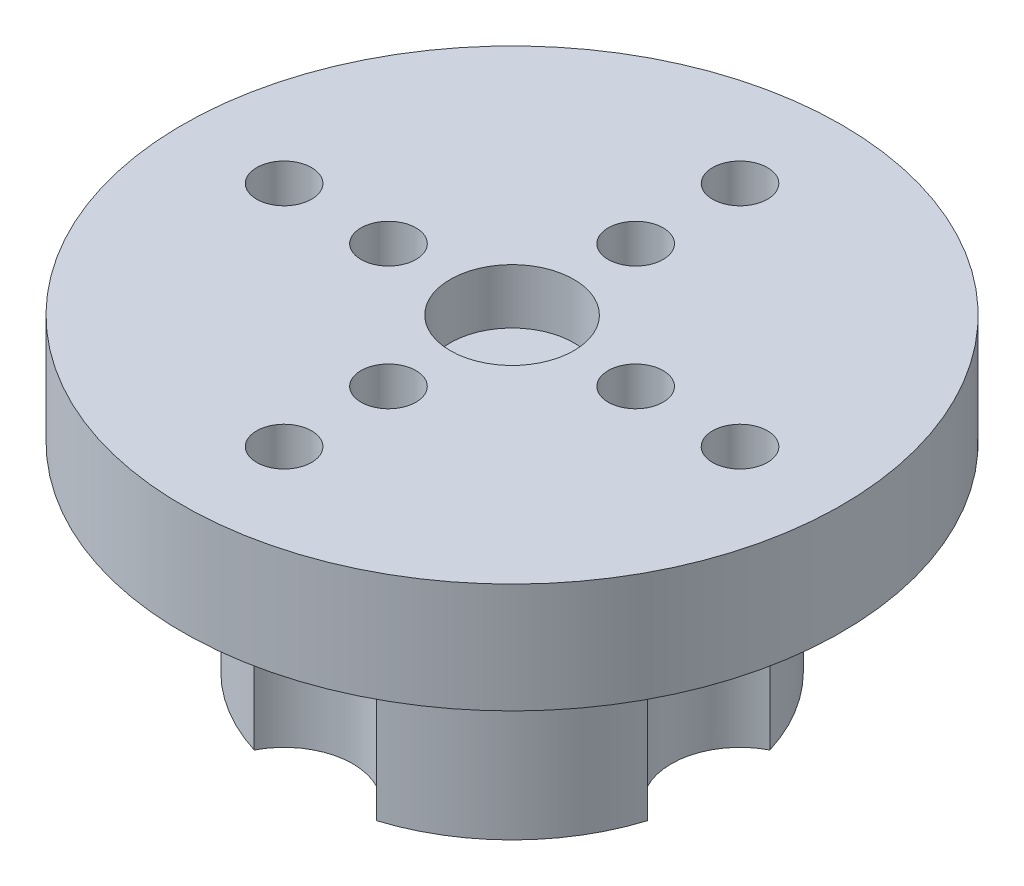
from build123d import *

# Parameters (mm, degrees)
SKETCH2_R          = 1
CUT_EXTRUDE1_DEPTH = 21.360807941
CIRPATTERN1_COUNT  = 4
SKETCH3_R          = 2.5
CUT_EXTRUDE2_DEPTH = 8
SKETCH4_R          = 2.25
CUT_EXTRUDE3_DEPTH = 2


with BuildPart() as part:
    # Sketch1 → Revolve1 (revolve)
    with BuildSketch(Plane.XY):
        Polygon((0, 11.25), (0, 0), (7.5, 0), (7.5, 5.25), (8.5, 5.25), (8.5, 7.25), (12, 7.25), (12, 11.25), align=None)
    revolve(axis=Axis((0, 0, 0), (0, 1, 0)))

    # Sketch2 → Cut-Extrude1 (cut, through all)
    with BuildSketch(Plane(origin=(0, 11.25, 0), x_dir=(1, 0, 0), z_dir=(0, 1, 0))):
        with Locations((8.3, 0)):
            Circle(SKETCH2_R)
        with Locations((4.5, 0)):
            Circle(SKETCH2_R)
    cut_extrude1 = extrude(amount=-CUT_EXTRUDE1_DEPTH, mode=Mode.SUBTRACT)

    # CirPattern1: Cut-Extrude1 ×4 about axis
    cirpattern1_axis = Axis((0, 11.25, 0), (0, -1, 0))
    for i in range(1, CIRPATTERN1_COUNT):
        add(cut_extrude1.rotate(cirpattern1_axis, i * 360 / CIRPATTERN1_COUNT), mode=Mode.SUBTRACT)

    # Sketch3 → Cut-Extrude2 (cut)
    with BuildSketch(Plane.XZ):
        with Locations((0, 8.3)):
            Circle(SKETCH3_R)
        with Locations((8.3, 0)):
            Circle(SKETCH3_R)
        with Locations((0, -8.3)):
            Circle(SKETCH3_R)
        with Locations((-8.3, 0)):
            Circle(SKETCH3_R)
    extrude(amount=-CUT_EXTRUDE2_DEPTH, mode=Mode.SUBTRACT)

    # Sketch4 → Cut-Extrude3 (cut)
    with BuildSketch(Plane(origin=(0, 11.25, 0), x_dir=(1, 0, 0), z_dir=(0, 1, 0))):
        Circle(SKETCH4_R)
    extrude(amount=-CUT_EXTRUDE3_DEPTH, mode=Mode.SUBTRACT)


solid = part.part
